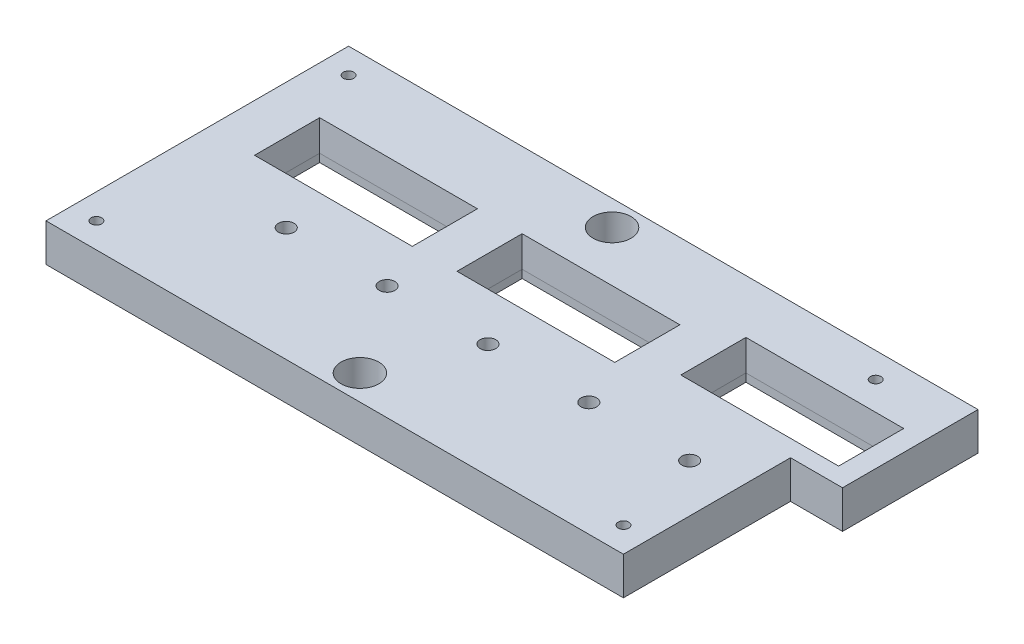
from build123d import *

# Parameters (mm, degrees)
SKETCH1_W            = 229
SKETCH1_H            = 120
BOSS_EXTRUDE1_DEPTH  = 15
SKETCH2_W            = 20.632503002
SKETCH2_H            = 53.730004003
BOSS_EXTRUDE2_DEPTH  = 15
CUT_EXTRUDE1_REACH   = 239.205
SKETCH3_W            = 61.75
SKETCH3_H            = 25
CUT_EXTRUDE2_REACH   = 239.205
SKETCH4_W            = 61.75
SKETCH4_H            = 25
CUT_EXTRUDE5_REACH   = 239.205
SKETCH10_W           = 61.75
SKETCH10_H           = 25
CUT_EXTRUDE3_REACH   = 239.205
SKETCH5_R            = 7.5
SKETCH9_R            = 6.25
CUT_EXTRUDE4_DEPTH   = 5
LPATTERN2_COUNT      = 4
LPATTERN2_PITCH      = 69.677
LPATTERN2_COUNT_DIR2 = 2
LPATTERN2_PITCH_DIR2 = 100
M5_TAPPED_HOLE1_D    = 4.2
CUT_EXTRUDE6_REACH   = 239.205
SKETCH14_R           = 3.1


with BuildPart() as part:
    # Sketch1 → Boss-Extrude1 (new body)
    with BuildSketch(Plane(origin=(0, 0, 0), x_dir=(1, 0, 0), z_dir=(0, 1, 0))):
        with Locations((-114.5, 0)):
            Rectangle(SKETCH1_W, SKETCH1_H)
    extrude(amount=-BOSS_EXTRUDE1_DEPTH)

    # Sketch2 → Boss-Extrude2 (add)
    with BuildSketch(Plane(origin=(0, 0, 0), x_dir=(1, 0, 0), z_dir=(0, 1, 0))):
        with Locations((10.316251501, 33.134997999)):
            Rectangle(SKETCH2_W, SKETCH2_H)
    extrude(amount=-BOSS_EXTRUDE2_DEPTH)

    # Sketch3 → Cut-Extrude1 (cut, up to next)
    with BuildSketch(Plane(origin=(0, 0, 0), x_dir=(1, 0, 0), z_dir=(0, 1, 0)), mode=Mode.PRIVATE) as cut_extrude1_sk1:
        with Locations((-18.875, 25.846108513)):
            Rectangle(SKETCH3_W, SKETCH3_H)
    cut_extrude1_tool1 = extrude(cut_extrude1_sk1.sketch, amount=-CUT_EXTRUDE1_REACH, mode=Mode.PRIVATE) & part.part
    add(cut_extrude1_tool1.solids().sort_by_distance((-18.875, 0, -25.846109))[0], mode=Mode.SUBTRACT)

    # Sketch4 → Cut-Extrude2 (cut, up to next)
    with BuildSketch(Plane(origin=(0, 0, 0), x_dir=(1, 0, 0), z_dir=(0, 1, 0)), mode=Mode.PRIVATE) as cut_extrude2_sk1:
        with Locations((-98.875, 17.083858316)):
            Rectangle(SKETCH4_W, SKETCH4_H)
    cut_extrude2_tool1 = extrude(cut_extrude2_sk1.sketch, amount=-CUT_EXTRUDE2_REACH, mode=Mode.PRIVATE) & part.part
    add(cut_extrude2_tool1.solids().sort_by_distance((-98.875, 0, -17.083858))[0], mode=Mode.SUBTRACT)

    # Sketch10 → Cut-Extrude5 (cut, up to next)
    with BuildSketch(Plane(origin=(0, 0, 0), x_dir=(1, 0, 0), z_dir=(0, 1, 0)), mode=Mode.PRIVATE) as cut_extrude5_sk1:
        with Locations((-178.875, 16.78)):
            Rectangle(SKETCH10_W, SKETCH10_H)
    cut_extrude5_tool1 = extrude(cut_extrude5_sk1.sketch, amount=-CUT_EXTRUDE5_REACH, mode=Mode.PRIVATE) & part.part
    add(cut_extrude5_tool1.solids().sort_by_distance((-178.875, 0, -16.78))[0], mode=Mode.SUBTRACT)

    # Sketch5 → Cut-Extrude3 (cut, up to next)
    with BuildSketch(Plane(origin=(0, 0, 0), x_dir=(1, 0, 0), z_dir=(0, 1, 0)), mode=Mode.PRIVATE) as cut_extrude3_sk1:
        with Locations(Location((-114.5, 50, 0), (0, 0, 270))):
            Circle(SKETCH5_R)
    cut_extrude3_tool1 = extrude(cut_extrude3_sk1.sketch, amount=-CUT_EXTRUDE3_REACH, mode=Mode.PRIVATE) & part.part
    # Sketch5 → Cut-Extrude3 (cut, up to next)
    with BuildSketch(Plane(origin=(0, 0, 0), x_dir=(1, 0, 0), z_dir=(0, 1, 0)), mode=Mode.PRIVATE) as cut_extrude3_sk2:
        with Locations(Location((-114.5, -50, 0), (0, 0, 270))):
            Circle(SKETCH5_R)
    cut_extrude3_tool2 = extrude(cut_extrude3_sk2.sketch, amount=-CUT_EXTRUDE3_REACH, mode=Mode.PRIVATE) & part.part
    add(cut_extrude3_tool1.solids().sort_by_distance((-114.5, 0, -50))[0], mode=Mode.SUBTRACT)
    add(cut_extrude3_tool2.solids().sort_by_distance((-114.5, 0, 50))[0], mode=Mode.SUBTRACT)

    # Sketch9 → Cut-Extrude4 (cut)
    with BuildSketch(Plane.XZ.offset(15)):
        with Locations(Location((-219, -50, 0), (0, 0, 270))):
            Circle(SKETCH9_R)
    cut_extrude4 = extrude(amount=-CUT_EXTRUDE4_DEPTH, mode=Mode.SUBTRACT)

    # LPattern2: Cut-Extrude4 4 × 2
    with Locations(*[(i * LPATTERN2_PITCH, 0, j * LPATTERN2_PITCH_DIR2) for i in range(LPATTERN2_COUNT) for j in range(LPATTERN2_COUNT_DIR2) if (i, j) != (0, 0)]):
        add(cut_extrude4, mode=Mode.SUBTRACT)

    # M5 Tapped Hole1 (through all)
    with Locations(Plane(origin=(0, -10, 0), x_dir=(-1, 0, 0), z_dir=(0, -1, 0))):
        with Locations((9.969, 50), (219, 50), (219, -50), (9.969, -50)):
            Hole(M5_TAPPED_HOLE1_D / 2)

    # Draft1: read off the stored shape, not the designer's step
    # Draft1: loft between two sections, ruled curve by curve
    draft1_from = [
        Edge.make_line((-50.16206508, 0, -38.758173593), (-50.16206508, 0, -12.934043433)),
        Edge.make_line((12.41206508, 0, -38.758173593), (-50.16206508, 0, -38.758173593)),
        Edge.make_line((12.41206508, 0, -12.934043433), (12.41206508, 0, -38.758173593)),
        Edge.make_line((-50.16206508, 0, -12.934043433), (12.41206508, 0, -12.934043433)),
    ]
    draft1_to = [
        Edge.make_line((-49.75, -11.8, -38.346108513), (-49.75, -11.8, -13.346108513)),
        Edge.make_line((12, -11.8, -38.346108513), (-49.75, -11.8, -38.346108513)),
        Edge.make_line((12, -11.8, -13.346108513), (12, -11.8, -38.346108513)),
        Edge.make_line((-49.75, -11.8, -13.346108513), (12, -11.8, -13.346108513)),
    ]
    draft1 = Solid(Shell([*[Face.make_surface_from_curves(draft1_from[k], draft1_to[k]) for k in range(4)], Face(Wire(draft1_from)), Face(Wire(draft1_to))]))
    add(draft1, mode=Mode.SUBTRACT)

    # Draft1 2: loft between two sections, ruled curve by curve
    draft1_2_from = [
        Edge.make_line((-130.16206508, 0, -29.995923396), (-130.16206508, 0, -4.171793236)),
        Edge.make_line((-67.58793492, 0, -29.995923396), (-130.16206508, 0, -29.995923396)),
        Edge.make_line((-67.58793492, 0, -4.171793236), (-67.58793492, 0, -29.995923396)),
        Edge.make_line((-130.16206508, 0, -4.171793236), (-67.58793492, 0, -4.171793236)),
    ]
    draft1_2_to = [
        Edge.make_line((-129.75, -11.8, -29.583858316), (-129.75, -11.8, -4.583858316)),
        Edge.make_line((-68, -11.8, -29.583858316), (-129.75, -11.8, -29.583858316)),
        Edge.make_line((-68, -11.8, -4.583858316), (-68, -11.8, -29.583858316)),
        Edge.make_line((-129.75, -11.8, -4.583858316), (-68, -11.8, -4.583858316)),
    ]
    draft1_2 = Solid(Shell([*[Face.make_surface_from_curves(draft1_2_from[k], draft1_2_to[k]) for k in range(4)], Face(Wire(draft1_2_from)), Face(Wire(draft1_2_to))]))
    add(draft1_2, mode=Mode.SUBTRACT)

    # Draft1 3: loft between two sections, ruled curve by curve
    draft1_3_from = [
        Edge.make_line((-210.16206508, 0, -29.69206508), (-210.16206508, 0, -3.86793492)),
        Edge.make_line((-147.58793492, 0, -29.69206508), (-210.16206508, 0, -29.69206508)),
        Edge.make_line((-147.58793492, 0, -3.86793492), (-147.58793492, 0, -29.69206508)),
        Edge.make_line((-210.16206508, 0, -3.86793492), (-147.58793492, 0, -3.86793492)),
    ]
    draft1_3_to = [
        Edge.make_line((-209.75, -11.8, -29.28), (-209.75, -11.8, -4.28)),
        Edge.make_line((-148, -11.8, -29.28), (-209.75, -11.8, -29.28)),
        Edge.make_line((-148, -11.8, -4.28), (-148, -11.8, -29.28)),
        Edge.make_line((-209.75, -11.8, -4.28), (-148, -11.8, -4.28)),
    ]
    draft1_3 = Solid(Shell([*[Face.make_surface_from_curves(draft1_3_from[k], draft1_3_to[k]) for k in range(4)], Face(Wire(draft1_3_from)), Face(Wire(draft1_3_to))]))
    add(draft1_3, mode=Mode.SUBTRACT)

    # Sketch14 → Cut-Extrude6 (cut, up to next)
    with BuildSketch(Plane(origin=(0, 0, 0), x_dir=(1, 0, 0), z_dir=(0, 1, 0)), mode=Mode.PRIVATE) as cut_extrude6_sk1:
        with Locations(Location((-179, -14.72, 0), (0, 0, 270))):
            Circle(SKETCH14_R)
    cut_extrude6_tool1 = extrude(cut_extrude6_sk1.sketch, amount=-CUT_EXTRUDE6_REACH, mode=Mode.PRIVATE) & part.part
    # Sketch14 → Cut-Extrude6 (cut, up to next)
    with BuildSketch(Plane(origin=(0, 0, 0), x_dir=(1, 0, 0), z_dir=(0, 1, 0)), mode=Mode.PRIVATE) as cut_extrude6_sk2:
        with Locations(Location((-139, -14.72, 0), (0, 0, 270))):
            Circle(SKETCH14_R)
    cut_extrude6_tool2 = extrude(cut_extrude6_sk2.sketch, amount=-CUT_EXTRUDE6_REACH, mode=Mode.PRIVATE) & part.part
    # Sketch14 → Cut-Extrude6 (cut, up to next)
    with BuildSketch(Plane(origin=(0, 0, 0), x_dir=(1, 0, 0), z_dir=(0, 1, 0)), mode=Mode.PRIVATE) as cut_extrude6_sk3:
        with Locations(Location((-99, -14.72, 0), (0, 0, 270))):
            Circle(SKETCH14_R)
    cut_extrude6_tool3 = extrude(cut_extrude6_sk3.sketch, amount=-CUT_EXTRUDE6_REACH, mode=Mode.PRIVATE) & part.part
    # Sketch14 → Cut-Extrude6 (cut, up to next)
    with BuildSketch(Plane(origin=(0, 0, 0), x_dir=(1, 0, 0), z_dir=(0, 1, 0)), mode=Mode.PRIVATE) as cut_extrude6_sk4:
        with Locations(Location((-59, -14.72, 0), (0, 0, 270))):
            Circle(SKETCH14_R)
    cut_extrude6_tool4 = extrude(cut_extrude6_sk4.sketch, amount=-CUT_EXTRUDE6_REACH, mode=Mode.PRIVATE) & part.part
    # Sketch14 → Cut-Extrude6 (cut, up to next)
    with BuildSketch(Plane(origin=(0, 0, 0), x_dir=(1, 0, 0), z_dir=(0, 1, 0)), mode=Mode.PRIVATE) as cut_extrude6_sk5:
        with Locations(Location((-19, -14.72, 0), (0, 0, 270))):
            Circle(SKETCH14_R)
    cut_extrude6_tool5 = extrude(cut_extrude6_sk5.sketch, amount=-CUT_EXTRUDE6_REACH, mode=Mode.PRIVATE) & part.part
    add(cut_extrude6_tool1.solids().sort_by_distance((-179, 0, 14.72))[0], mode=Mode.SUBTRACT)
    add(cut_extrude6_tool2.solids().sort_by_distance((-139, 0, 14.72))[0], mode=Mode.SUBTRACT)
    add(cut_extrude6_tool3.solids().sort_by_distance((-99, 0, 14.72))[0], mode=Mode.SUBTRACT)
    add(cut_extrude6_tool4.solids().sort_by_distance((-59, 0, 14.72))[0], mode=Mode.SUBTRACT)
    add(cut_extrude6_tool5.solids().sort_by_distance((-19, 0, 14.72))[0], mode=Mode.SUBTRACT)


solid = part.part
